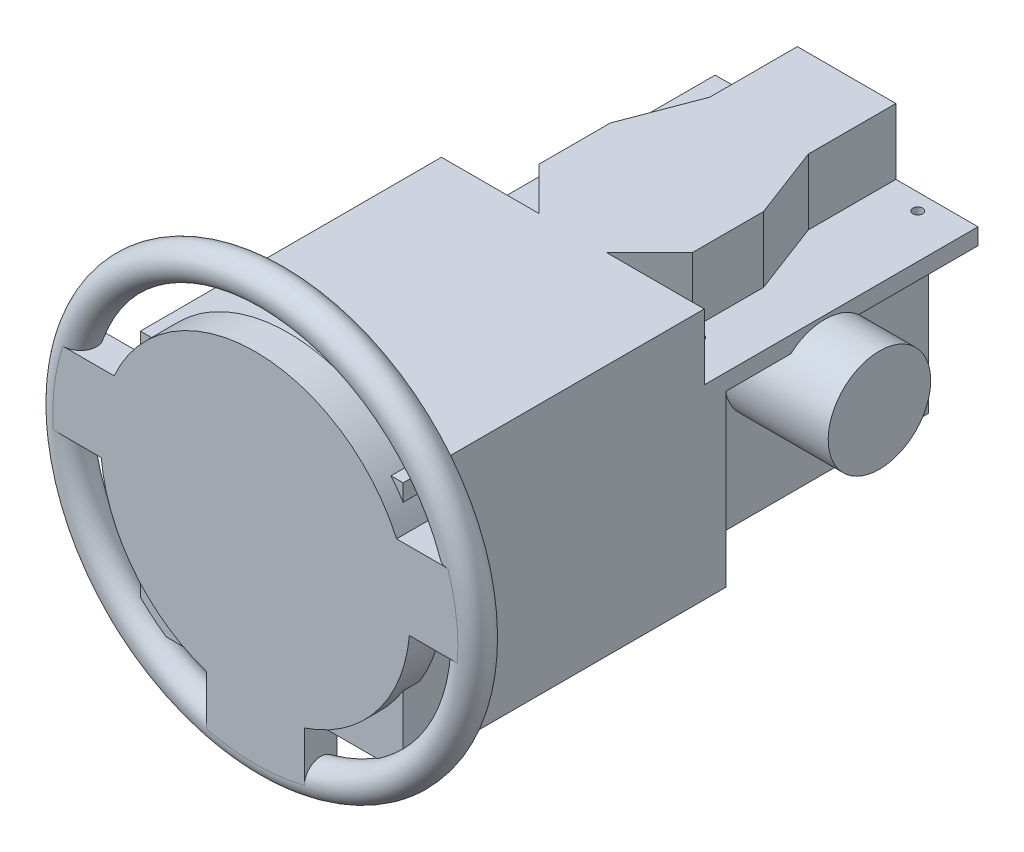
from build123d import *
from build123d.topology import SkipClean

# Parameters (mm, degrees)
SZKIC4_R                                = 15
DODANIE_WYCI_GNI_CIE1_DEPTH             = 15
DODANIE_WYCI_GNI_CIE1_DEPTH_BACK        = 15
SZKIC7_W                                = 240
SZKIC7_H                                = 230
DODANIE_WYCI_GNI_CIE2_DEPTH             = 525
SZKIC9_W                                = 50
SZKIC9_H                                = 60
WYTNIJ_WYCI_GNI_CIE1_DEPTH              = 250
SZKIC10_W                               = 45
SZKIC10_H                               = 155
WYTNIJ_WYCI_GNI_CIE2_DEPTH              = 230
SZKIC11_R                               = 4.5
WYTNIJ_WYCI_GNI_CIE3_DEPTH              = 230
SZKIC12_W                               = 30
SZKIC12_H                               = 40
WYTNIJ_WYCI_GNI_CIE4_DEPTH              = 230
DODANIE_WYCI_GNI_CIE3_REACH             = 648.549
SZKIC13_R                               = 46.812335414
DODANIE_WYCI_GNI_CIE3_DIRECTION_2_DEPTH = 50
WYTNIJ_WYCI_GNI_CIE5_DEPTH              = 60


with BuildPart() as part:
    # Szkic4 → Obrót2 (revolve)
    with BuildSketch(Plane(origin=(0, 0, 0), x_dir=(1, 0, 0), z_dir=(0, 1, 0))):
        with Locations((-185, 0)):
            Circle(SZKIC4_R)
    revolve(axis=Axis((0, 0, 0), (0, 0, 1)))


with BuildPart() as body_2:
    # Szkic5 → Dodanie-wyciągnięcie1 (new, two sides: drawn at the far end of the back side and taken through both)
    with BuildSketch(Plane.XY.offset(-DODANIE_WYCI_GNI_CIE1_DEPTH_BACK)):
        with BuildLine():
            Line((-175.784791428, 57.660273174), (-128.974817238, 57.660273174))
            ThreePointArc((-128.974817238, 57.660273174), (0, 141.27707027), (128.974817238, 57.660273174))
            Line((128.974817238, 57.660273174), (175.784791428, 57.660273174))
            ThreePointArc((175.784791428, 57.660273174), (183.591228006, 22.787299076), (184.547178384, -12.935955722))
            Line((184.547178384, -12.935955722), (140.683586937, -12.935955722))
            ThreePointArc((140.683586937, -12.935955722), (110.735716474, -87.731474859), (44.773765108, -133.994479521))
            Line((44.773765108, -133.994479521), (44.773765108, -179.500167014))
            ThreePointArc((44.773765108, -179.500167014), (0, -185), (-44.773765108, -179.500167014))
            Line((-44.773765108, -179.500167014), (-44.773765108, -133.994479521))
            ThreePointArc((-44.773765108, -133.994479521), (-110.735716474, -87.731474859), (-140.683586937, -12.935955722))
            Line((-140.683586937, -12.935955722), (-184.547178384, -12.935955722))
            ThreePointArc((-184.547178384, -12.935955722), (-183.591228006, 22.787299076), (-175.784791428, 57.660273174))
        make_face()
    extrude(amount=DODANIE_WYCI_GNI_CIE1_DEPTH + DODANIE_WYCI_GNI_CIE1_DEPTH_BACK)


with BuildPart() as dodanie_wyci_gni_cie2_tool:
    # Szkic7 → Dodanie-wyciągnięcie2 (new body)
    with BuildSketch(Plane.XY):
        with Locations((0, -25)):
            Rectangle(SZKIC7_W, SZKIC7_H)
    extrude(amount=-DODANIE_WYCI_GNI_CIE2_DEPTH)


with BuildPart() as part_1:
    add(part.part)


with BuildPart() as part_2:
    # Dodanie-wyciągnięcie2: joined with dodanie_wyci_gni_cie2_tool
    add(part_1.part.fuse(dodanie_wyci_gni_cie2_tool.part, body_2.part, tol=0.00001))

    # Szkic9 → Wytnij-wyciągnięcie1 (cut)
    with BuildSketch(Plane(origin=(0, 0, -525), x_dir=(-1, 0, 0), z_dir=(0, 0, -1))):
        with Locations((-95, 60)):
            Rectangle(SZKIC9_W, SZKIC9_H)
        with Locations((95, 60)):
            Rectangle(SZKIC9_W, SZKIC9_H)
    extrude(amount=-WYTNIJ_WYCI_GNI_CIE1_DEPTH, mode=Mode.SUBTRACT)

    # Szkic10 → Wytnij-wyciągnięcie2 (cut)
    with BuildSketch(Plane(origin=(0, 0, -525), x_dir=(-1, 0, 0), z_dir=(0, 0, -1))):
        with Locations((97.5, -62.5)):
            Rectangle(SZKIC10_W, SZKIC10_H)
        with Locations((-97.5, -62.5)):
            Rectangle(SZKIC10_W, SZKIC10_H)
    extrude(amount=-WYTNIJ_WYCI_GNI_CIE2_DEPTH, mode=Mode.SUBTRACT)

    # Szkic11 → Wytnij-wyciągnięcie3 (cut)
    with BuildSketch(Plane(origin=(0, 30, 0), x_dir=(1, 0, 0), z_dir=(0, 1, 0))):
        with Locations(Location((80, 510, 0), (0, 0, 270))):
            Circle(SZKIC11_R)
        with Locations(Location((80, 310, 0), (0, 0, 270))):
            Circle(SZKIC11_R)
        with Locations(Location((-80, 310, 0), (0, 0, 270))):
            Circle(SZKIC11_R)
        with Locations(Location((-80, 510, 0), (0, 0, 270))):
            Circle(SZKIC11_R)
    extrude(amount=-WYTNIJ_WYCI_GNI_CIE3_DEPTH, mode=Mode.SUBTRACT)

    # Szkic12 → Wytnij-wyciągnięcie4 (cut)
    with BuildSketch(Plane(origin=(0, 0, -525), x_dir=(-1, 0, 0), z_dir=(0, 0, -1))):
        with Locations((-60, -5)):
            Rectangle(SZKIC12_W, SZKIC12_H)
        with Locations((60, -5)):
            Rectangle(SZKIC12_W, SZKIC12_H)
    extrude(amount=-WYTNIJ_WYCI_GNI_CIE4_DEPTH, mode=Mode.SUBTRACT)

    # Dodanie-wyciągnięcie3: up to this face of the body (flat: up to its plane)
    dodanie_wyci_gni_cie3_end = Plane(part_2.part.faces().sort_by_distance((45, -5, -410))[0])
    # Szkic13 → Dodanie-wyciągnięcie3 (add, up to the picked face)
    with BuildSketch(Plane(origin=(120, 0, 0), x_dir=(0, 0, -1), z_dir=(1, 0, 0)), mode=Mode.PRIVATE) as dodanie_wyci_gni_cie3_sk1:
        with Locations(Location((385, -20, 0), (0, 0, 186.131427001))):
            Circle(SZKIC13_R)
    dodanie_wyci_gni_cie3_tool1 = split(extrude(dodanie_wyci_gni_cie3_sk1.sketch, amount=-DODANIE_WYCI_GNI_CIE3_REACH, mode=Mode.PRIVATE), bisect_by=dodanie_wyci_gni_cie3_end, keep=Keep.BOTH, mode=Mode.PRIVATE)
    add(dodanie_wyci_gni_cie3_tool1.solids().sort_by(Axis((120, -20, -385), (-1, 0, 0)))[0])

    # Szkic13 → Dodanie-wyciągnięcie3 direction 2 (add)
    with SkipClean():  # the faces are left unmerged after this step: merging them gives an invalid solid
        with BuildSketch(Plane(origin=(120, 0, 0), x_dir=(0, 0, -1), z_dir=(1, 0, 0))):
            with Locations(Location((385, -20, 0), (0, 0, 186.131427001))):
                Circle(SZKIC13_R)
        extrude(amount=DODANIE_WYCI_GNI_CIE3_DIRECTION_2_DEPTH)

    # Szkic14 → Wytnij-wyciągnięcie5 (cut)
    with SkipClean():  # the faces are left unmerged after this step: merging them gives an invalid solid
        with BuildSketch(Plane(origin=(0, 90, 0), x_dir=(1, 0, 0), z_dir=(0, 1, 0))):
            Polygon((70, 275), (70, 314.142135624), (30.857864376, 275), align=None)
            Polygon((-70, 275), (-30.857864376, 275), (-70, 314.142135624), align=None)
            Polygon((-70, 525), (-70, 379.142135624), (-45, 445), (-45, 525), align=None)
            Polygon((45, 445), (70, 379.142135624), (70, 525), (45, 525), align=None)
        extrude(amount=-WYTNIJ_WYCI_GNI_CIE5_DEPTH, mode=Mode.SUBTRACT)


solid = part_2.part
